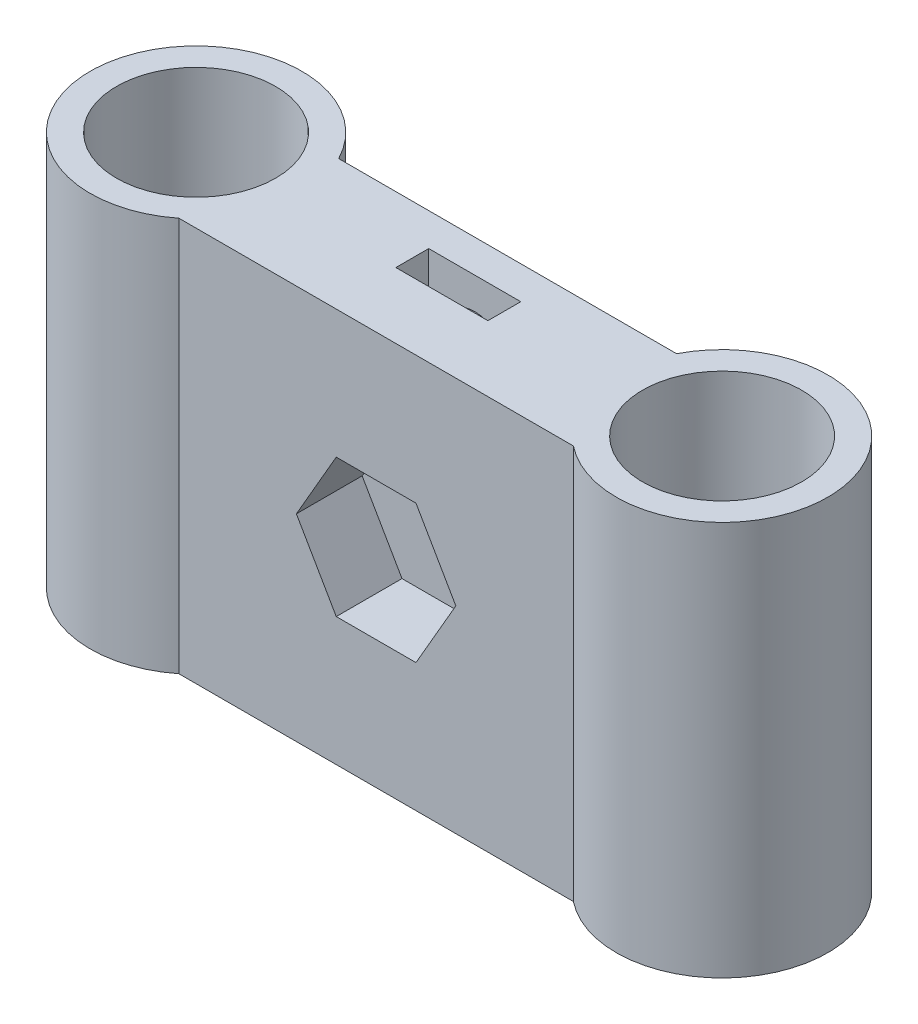
from build123d import *

# Parameters (mm, degrees)
SKICA1_W                 = 30
SKICA1_H                 = 30
P_IDAT_VYSUNUT_M1_DEPTH  = 5
SKICA2_W                 = 30
SKICA2_H                 = 30
P_IDAT_VYSUNUT_M2_DEPTH  = 5
ODEBRAT_VYSUNUT_M1_DEPTH = 30
ODEBRAT_VYSUNUT_M2_DEPTH = 30
SKICA7_W                 = 7
SKICA7_H                 = 2.5
ODEBRAT_VYSUNUT_M3_DEPTH = 30
SKICA10_R                = 8.05
SKICA10_R_2              = 6.05
P_IDAT_VYSUNUT_M7_DEPTH  = 30
SKICA13_W                = 7
SKICA13_H                = 3
ODEBRAT_VYSUNUT_M5_DEPTH = 2.5
SKICA15_R                = 2.35
ODEBRAT_VYSUNUT_M6_DEPTH = 1.7
SKICA16_W                = 3.5
SKICA16_H                = 5
P_IDAT_VYSUNUT_M8_DEPTH  = 5
ODEBRAT_VYSUNUT_M7_DEPTH = 0.8
ZAOBLIT1_R               = 4
ZAOBLIT2_R               = 4
ODEBRAT_VYSUNUT_M8_DEPTH = 5


with BuildPart() as part:
    # Skica1 → Přidat vysunutím1 (new body)
    with BuildSketch(Plane.XY):
        with Locations((-15, -15)):
            Rectangle(SKICA1_W, SKICA1_H)
    extrude(amount=P_IDAT_VYSUNUT_M1_DEPTH)

    # Skica2 → Přidat vysunutím2 (add)
    with BuildSketch(Plane(origin=(0, 0, 0), x_dir=(-1, 0, 0), z_dir=(0, 0, -1))):
        with Locations((15, -15)):
            Rectangle(SKICA2_W, SKICA2_H)
    extrude(amount=P_IDAT_VYSUNUT_M2_DEPTH)

    # Skica4 → Odebrat vysunutím1 (cut)
    with BuildSketch(Plane(origin=(0, -30, 0), x_dir=(-1, 0, 0), z_dir=(0, -1, 0))):
        with BuildLine():
            Line((30, -5), (30, 5))
            ThreePointArc((30, 5), (28.123635209, 0), (30, -5))
        make_face()
    extrude(amount=-ODEBRAT_VYSUNUT_M1_DEPTH, mode=Mode.SUBTRACT)

    # Skica5 → Odebrat vysunutím2 (cut)
    with BuildSketch(Plane(origin=(0, -30, 0), x_dir=(-1, 0, 0), z_dir=(0, -1, 0))):
        with BuildLine():
            ThreePointArc((0, -5), (1.909830056, 0), (0, 5))
            Line((0, 5), (0, -5))
        make_face()
    extrude(amount=-ODEBRAT_VYSUNUT_M2_DEPTH, mode=Mode.SUBTRACT)

    # Skica7 → Odebrat vysunutím3 (cut)
    with BuildSketch(Plane(origin=(0, 0, 0), x_dir=(1, 0, 0), z_dir=(0, 1, 0))):
        with Locations((-15, 1.25)):
            Rectangle(SKICA7_W, SKICA7_H)
    extrude(amount=-ODEBRAT_VYSUNUT_M3_DEPTH, mode=Mode.SUBTRACT)

    # Skica10 → Přidat vysunutím7 (add)
    # profile 1 of 2: a face of its own
    with BuildSketch(Plane.XZ.offset(30)):
        with Locations((-35, -1.308922253)):
            Circle(SKICA10_R)
        with Locations((-35, -1.308922253)):
            Circle(SKICA10_R_2, mode=Mode.SUBTRACT)
    # profile 2 of 2: a face of its own
    with BuildSketch(Plane.XZ.offset(30)):
        with Locations((5, -1.308922253)):
            Circle(SKICA10_R)
        with Locations((5, -1.308922253)):
            Circle(SKICA10_R_2, mode=Mode.SUBTRACT)
    extrude(amount=-P_IDAT_VYSUNUT_M7_DEPTH)

    # Skica13 → Odebrat vysunutím5 (cut)
    with BuildSketch(Plane(origin=(0, 0, -5), x_dir=(-1, 0, 0), z_dir=(0, 0, -1))):
        with Locations((15, -19)):
            Rectangle(SKICA13_W, SKICA13_H)
        with Locations((15, -11)):
            Rectangle(SKICA13_W, SKICA13_H)
    extrude(amount=-ODEBRAT_VYSUNUT_M5_DEPTH, mode=Mode.SUBTRACT)

    # Skica15 → Odebrat vysunutím6 (cut)
    with BuildSketch(Plane.XY.offset(-2.5)):
        with Locations((-15, -25.25)):
            Circle(SKICA15_R)
        with Locations(Location((-15, -4.75, 0), (0, 0, 180))):
            Circle(SKICA15_R)
    extrude(amount=-ODEBRAT_VYSUNUT_M6_DEPTH, mode=Mode.SUBTRACT)

    # Skica16 → Přidat vysunutím8 (add)
    with BuildSketch(Plane(origin=(0, 0, -5), x_dir=(-1, 0, 0), z_dir=(0, 0, -1))):
        with Locations((13.25, -15)):
            Rectangle(SKICA16_W, SKICA16_H)
        with Locations((16.75, -15)):
            Rectangle(SKICA16_W, SKICA16_H)
    extrude(amount=-P_IDAT_VYSUNUT_M8_DEPTH)

    # Skica16<3> → Odebrat vysunutím7 (cut)
    with BuildSketch(Plane(origin=(0, 0, -5), x_dir=(-1, 0, 0), z_dir=(0, 0, -1))):
        with BuildLine():
            ThreePointArc((16, -4.75), (15.707106781, -4.042893219), (15, -3.75))
            Line((15, -3.75), (15, -5.75))
            ThreePointArc((15, -5.75), (15.707106781, -5.457106781), (16, -4.75))
        make_face()
        with BuildLine():
            Line((15, -5.75), (15, -3.75))
            ThreePointArc((15, -3.75), (14, -4.75), (15, -5.75))
        make_face()
        with BuildLine():
            ThreePointArc((15, -24.25), (14, -25.25), (15, -26.25))
            Line((15, -26.25), (15, -24.25))
        make_face()
        with BuildLine():
            Line((15, -24.25), (15, -26.25))
            ThreePointArc((15, -26.25), (15.707106781, -25.957106781), (16, -25.25))
            ThreePointArc((16, -25.25), (15.707106781, -24.542893219), (15, -24.25))
        make_face()
    extrude(amount=-ODEBRAT_VYSUNUT_M7_DEPTH, mode=Mode.SUBTRACT)

    # Zaoblit1
    zaoblit1_edges = [part.edges().sort_by_distance(p)[0] for p in [
        (-15, -17.5, 0),
        (-15, -12.5, 0),
    ]]
    fillet(zaoblit1_edges, radius=ZAOBLIT1_R)

    # Zaoblit2
    # the kernel refuses this fillet: 4 mm, written as the material it takes off along each edge
    with BuildSketch(Plane(origin=(-18.5, -20.5, -2.5), x_dir=(0, 0, -1), z_dir=(1, 0, 0)), Plane(origin=(-11.5, -9.5, -2.5), x_dir=(0, 0, -1), z_dir=(-1, 0, 0))) as zaoblit2_piece_1:
        with BuildLine():
            CenterArc((4, -3.708099244), ZAOBLIT2_R, 112.024312837, 67.975687163)
            Line((0, -3.708099244), (-0.08, -3.708099244))
            Line((-0.08, -3.708099244), (-0.08, 0))
            Line((-0.08, 0), (0, 0.08))
            ThreePointArc((0, 0.08), (1.25, 0.08), (2.47, 0.074161985))
            Line((2.47, 0.074161985), (2.5, 0))
        make_face()
    extrude(amount=7, mode=Mode.SUBTRACT)

    # Skica17 → Odebrat vysunutím8 (cut)
    with BuildSketch(Plane.XY.offset(5)):
        Polygon((-8.937822174, -15), (-11.968911087, -9.75), (-18.031088913, -9.75), (-21.062177826, -15), (-18.031088913, -20.25), (-11.968911087, -20.25), align=None)
    extrude(amount=-ODEBRAT_VYSUNUT_M8_DEPTH, mode=Mode.SUBTRACT)


solid = part.part
